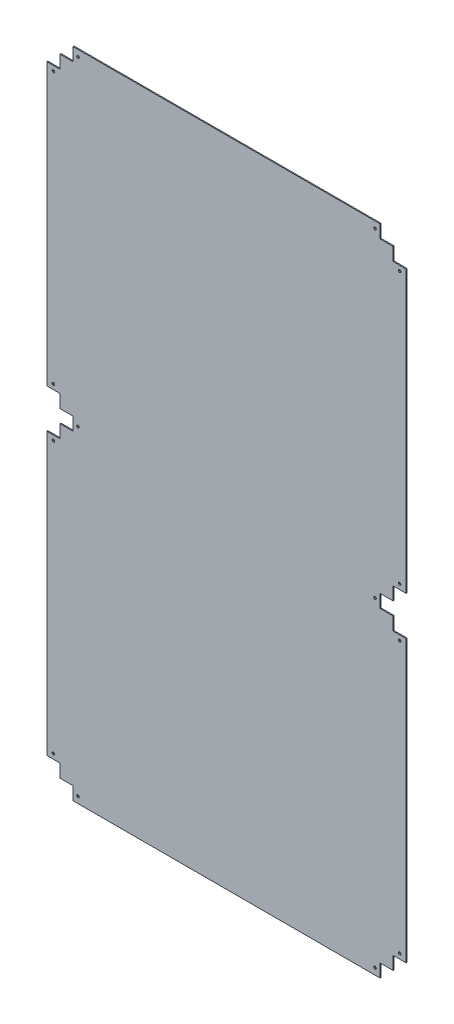
from build123d import *

# Parameters (mm, degrees)
SCHIZZO1_W               = 1100
SCHIZZO1_H               = 2000
BASE_FLANGIA1_DEPTH      = 3
TAGLIO_ESTRUSIONE1_DEPTH = 1142.275164016
TAGLIO_ESTRUSIONE3_DEPTH = 1142.275164016
SCHIZZO6_R               = 4
TAGLIO_ESTRUSIONE4_DEPTH = 1142.275164016


# Sheet-metal steps are written as plain solids
with BuildPart() as part:
    # Schizzo1 → Base-Flangia1 (new body)
    with BuildSketch(Plane.XY):
        Rectangle(SCHIZZO1_W, SCHIZZO1_H)
    extrude(amount=-BASE_FLANGIA1_DEPTH)

    # Schizzo2 → Taglio-Estrusione1 (cut, through all)
    with BuildSketch(Plane.XY):
        Polygon((-550, -1000), (-470, -1000), (-470, -960), (-510, -960), (-510, -920), (-550, -920), align=None)
        Polygon((550, -1000), (470, -1000), (470, -960), (510, -960), (510, -920), (550, -920), align=None)
        Polygon((550, 1000), (470, 1000), (470, 960), (510, 960), (510, 920), (550, 920), align=None)
        Polygon((-550, 1000), (-550, 920), (-510, 920), (-510, 960), (-470, 960), (-470, 1000), align=None)
    extrude(amount=-TAGLIO_ESTRUSIONE1_DEPTH, mode=Mode.SUBTRACT)

    # Schizzo4 → Taglio-Estrusione3 (cut, through all)
    with BuildSketch(Plane.XY):
        Polygon((-550, -60), (-550, 60), (-510, 60), (-510, 20), (-470, 20), (-470, -20), (-510, -20), (-510, -60), align=None)
        Polygon((510, 20), (470, 20), (470, -20), (510, -20), (510, -60), (550, -60), (550, 60), (510, 60), align=None)
    extrude(amount=-TAGLIO_ESTRUSIONE3_DEPTH, mode=Mode.SUBTRACT)

    # Schizzo6 → Taglio-Estrusione4 (cut, through all)
    with BuildSketch(Plane(origin=(0, 0, -3), x_dir=(-1, 0, 0), z_dir=(0, 0, -1))):
        with Locations(Location((-454.75, -980, 0), (0, 0, 180))):
            Circle(SCHIZZO6_R)
        with Locations(Location((-530, -904.75, 0), (0, 0, 180))):
            Circle(SCHIZZO6_R)
        with Locations(Location((-530, -75.25, 0), (0, 0, 180))):
            Circle(SCHIZZO6_R)
        with Locations(Location((-454.75, 0, 0), (0, 0, 180))):
            Circle(SCHIZZO6_R)
        with Locations(Location((-530, 75.25, 0), (0, 0, 180))):
            Circle(SCHIZZO6_R)
        with Locations(Location((-530, 904.75, 0), (0, 0, 180))):
            Circle(SCHIZZO6_R)
        with Locations(Location((-454.75, 980, 0), (0, 0, 180))):
            Circle(SCHIZZO6_R)
        with Locations((454.75, 980)):
            Circle(SCHIZZO6_R)
        with Locations((530, 904.75)):
            Circle(SCHIZZO6_R)
        with Locations((530, 75.25)):
            Circle(SCHIZZO6_R)
        with Locations((454.75, 0)):
            Circle(SCHIZZO6_R)
        with Locations((530, -75.25)):
            Circle(SCHIZZO6_R)
        with Locations((530, -904.75)):
            Circle(SCHIZZO6_R)
        with Locations((454.75, -980)):
            Circle(SCHIZZO6_R)
    extrude(amount=-TAGLIO_ESTRUSIONE4_DEPTH, mode=Mode.SUBTRACT)


solid = part.part
